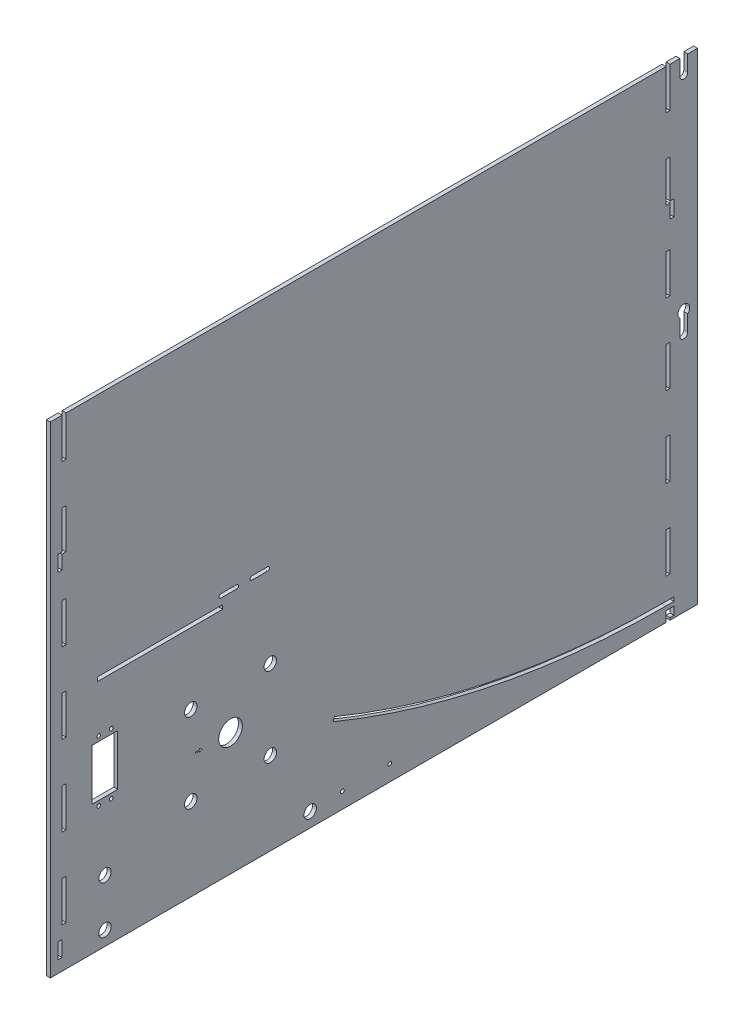
from build123d import *

# Parameters (mm, degrees)
SKETCH1_W           = 520.7
SKETCH1_H           = 387.35
SKETCH1_R           = 5
SKETCH1_R_2         = 1.5
SKETCH1_W_2         = 20.5
SKETCH1_H_2         = 41
SKETCH1_W_3         = 100.522513204
SKETCH1_H_3         = 3.175
SKETCH1_R_3         = 9.525
BOSS_EXTRUDE1_DEPTH = 3.175
SKETCH2_W           = 3.175
SKETCH2_H           = 32.279166667
SKETCH2_H_2         = 32.279166666
CUT_EXTRUDE1_DEPTH  = 471.296707542
SKETCH3_W           = 6.35
SKETCH3_H           = 3.175
CUT_EXTRUDE2_DEPTH  = 471.296707542
SKETCH4_R           = 5
CUT_EXTRUDE3_DEPTH  = 471.296707542
SKETCH5_R           = 1.5
CUT_EXTRUDE4_DEPTH  = 471.296707542
SKETCH6_W           = 3.175
SKETCH6_H           = 12.7
CUT_EXTRUDE5_DEPTH  = 471.296707542
CUT_EXTRUDE6_DEPTH  = 471.296707542


with BuildPart() as part:
    # Sketch1 → Boss-Extrude1 (new body)
    with BuildSketch(Plane(origin=(0, 0, 0), x_dir=(0, 0, -1), z_dir=(1, 0, 0))):
        with Locations((6.35, 193.675)):
            Rectangle(SKETCH1_W, SKETCH1_H)
        with Locations((-141.027486796, 66.552)):
            Circle(SKETCH1_R, mode=Mode.SUBTRACT)
        with Locations((-77.027486796, 66.552)):
            Circle(SKETCH1_R, mode=Mode.SUBTRACT)
        with Locations((-215.115692196, 100.3947974)):
            Circle(SKETCH1_R_2, mode=Mode.SUBTRACT)
        with Locations((-204.955692196, 100.3947974)):
            Circle(SKETCH1_R_2, mode=Mode.SUBTRACT)
        with Locations((-210.035692196, 124.7947974)):
            Rectangle(SKETCH1_W_2, SKETCH1_H_2, mode=Mode.SUBTRACT)
        with Locations((-141.027486796, 130.552)):
            Circle(SKETCH1_R, mode=Mode.SUBTRACT)
        with Locations((-215.115692196, 149.1947974)):
            Circle(SKETCH1_R_2, mode=Mode.SUBTRACT)
        with Locations((-204.955692196, 149.1947974)):
            Circle(SKETCH1_R_2, mode=Mode.SUBTRACT)
        with Locations((-165.638743398, 189.1665)):
            Rectangle(SKETCH1_W_3, SKETCH1_H_3, mode=Mode.SUBTRACT)
        with Locations((-109.027486796, 98.552)):
            Circle(SKETCH1_R_3, mode=Mode.SUBTRACT)
        with Locations((-77.027486796, 130.552)):
            Circle(SKETCH1_R, mode=Mode.SUBTRACT)
        with BuildLine():
            ThreePointArc((241.3, 11.557), (104.709921611, 25.009948505), (-26.631076666, 64.851804754))
            Line((-26.631076666, 64.851804754), (-25.416056769, 67.78512227))
            ThreePointArc((-25.416056769, 67.78512227), (105.329333383, 28.12394177), (241.3, 14.732))
            Line((241.3, 14.732), (241.3, 11.557))
        make_face(mode=Mode.SUBTRACT)
        with BuildLine():
            ThreePointArc((-116.877486796, 196.079), (-118.377486796, 197.579), (-116.877486796, 199.079))
            Line((-116.877486796, 199.079), (-104.177486796, 199.079))
            ThreePointArc((-104.177486796, 199.079), (-102.677486796, 197.579), (-104.177486796, 196.079))
            Line((-104.177486796, 196.079), (-116.877486796, 196.079))
        make_face(mode=Mode.SUBTRACT)
        with BuildLine():
            Line((-79.177486758, 196.079), (-91.877486758, 196.079))
            ThreePointArc((-91.877486758, 196.079), (-93.377486758, 197.579), (-91.877486758, 199.079))
            Line((-91.877486758, 199.079), (-79.177486758, 199.079))
            ThreePointArc((-79.177486758, 199.079), (-77.677486758, 197.579), (-79.177486758, 196.079))
        make_face(mode=Mode.SUBTRACT)
    extrude(amount=BOSS_EXTRUDE1_DEPTH)

    # Sketch2 → Cut-Extrude1 (cut, through all)
    with BuildSketch(Plane.ZY):
        with Locations((242.8875, 371.210416667)):
            Rectangle(SKETCH2_W, SKETCH2_H)
        with Locations((-242.8875, 371.210416667)):
            Rectangle(SKETCH2_W, SKETCH2_H)
        with Locations((-242.8875, 306.652083334)):
            Rectangle(SKETCH2_W, SKETCH2_H)
        with Locations((242.8875, 306.652083334)):
            Rectangle(SKETCH2_W, SKETCH2_H)
        with Locations((-242.8875, 242.09375)):
            Rectangle(SKETCH2_W, SKETCH2_H_2)
        with Locations((242.8875, 242.09375)):
            Rectangle(SKETCH2_W, SKETCH2_H_2)
        with Locations((-242.8875, 177.535416666)):
            Rectangle(SKETCH2_W, SKETCH2_H)
        with Locations((242.8875, 177.535416666)):
            Rectangle(SKETCH2_W, SKETCH2_H)
        with Locations((-242.8875, 112.977083334)):
            Rectangle(SKETCH2_W, SKETCH2_H)
        with Locations((242.8875, 112.977083334)):
            Rectangle(SKETCH2_W, SKETCH2_H)
        with Locations((-242.8875, 48.41875)):
            Rectangle(SKETCH2_W, SKETCH2_H_2)
        with Locations((242.8875, 48.41875)):
            Rectangle(SKETCH2_W, SKETCH2_H_2)
    extrude(amount=-CUT_EXTRUDE1_DEPTH, mode=Mode.SUBTRACT)

    # Sketch3 → Cut-Extrude2 (cut, through all)
    with BuildSketch(Plane.ZY):
        with BuildLine():
            Line((-252.4125, 193.675), (-252.4125, 206.375))
            ThreePointArc((-252.4125, 206.375), (-255.5875, 214.687257914), (-258.7625, 206.375))
            Line((-258.7625, 206.375), (-258.7625, 193.675))
            ThreePointArc((-258.7625, 193.675), (-255.5875, 190.5), (-252.4125, 193.675))
        make_face()
        with BuildLine():
            ThreePointArc((-258.7625, 374.65), (-257.83256403, 372.40493597), (-255.5875, 371.475))
            ThreePointArc((-255.5875, 371.475), (-253.34243597, 372.40493597), (-252.4125, 374.65))
            Line((-252.4125, 374.65), (-252.4125, 387.35))
            Line((-252.4125, 387.35), (-258.7625, 387.35))
            Line((-258.7625, 387.35), (-258.7625, 374.65))
        make_face()
        with Locations((-244.475, 13.1445)):
            Rectangle(SKETCH3_W, SKETCH3_H)
    extrude(amount=-CUT_EXTRUDE2_DEPTH, mode=Mode.SUBTRACT)

    # Sketch4 → Cut-Extrude3 (cut, through all)
    with BuildSketch(Plane.ZY):
        with Locations((210.035692196, 49.5947974)):
            Circle(SKETCH4_R)
        with Locations((44.935692196, 11.4947974)):
            Circle(SKETCH4_R)
        with Locations((210.035692196, 11.4947974)):
            Circle(SKETCH4_R)
    extrude(amount=-CUT_EXTRUDE3_DEPTH, mode=Mode.SUBTRACT)

    # Sketch5 → Cut-Extrude4 (cut, through all)
    with BuildSketch(Plane.ZY):
        with Locations((-19.05, 12.7)):
            Circle(SKETCH5_R)
        with Locations((19.05, 12.7)):
            Circle(SKETCH5_R)
    extrude(amount=-CUT_EXTRUDE4_DEPTH, mode=Mode.SUBTRACT)

    # Sketch6 → Cut-Extrude5 (cut, through all)
    with BuildSketch(Plane.ZY):
        with Locations((246.0625, 285.75)):
            Rectangle(SKETCH6_W, SKETCH6_H)
        with Locations((246.0625, 15.875)):
            Rectangle(SKETCH6_W, SKETCH6_H)
        with Locations((-246.0625, 285.75)):
            Rectangle(SKETCH6_W, SKETCH6_H)
        Polygon((-247.65, 1.905), (-244.475, 1.905), (-244.475, 0), (-241.3, 0), (-241.3, 8.255), (-247.65, 8.255), align=None)
    extrude(amount=-CUT_EXTRUDE5_DEPTH, mode=Mode.SUBTRACT)

    # Sketch7 → Cut-Extrude6 (cut, through all)
    with BuildSketch(Plane.ZY):
        Polygon((137.124709789, 98.155125), (137.124709789, 98.948875), (133.949709789, 98.948875), (133.949709789, 99.742625), (131.887486796, 98.552), (133.949709789, 97.361375), (133.949709789, 98.155125), align=None)
    extrude(amount=-CUT_EXTRUDE6_DEPTH, mode=Mode.SUBTRACT)


solid = part.part
